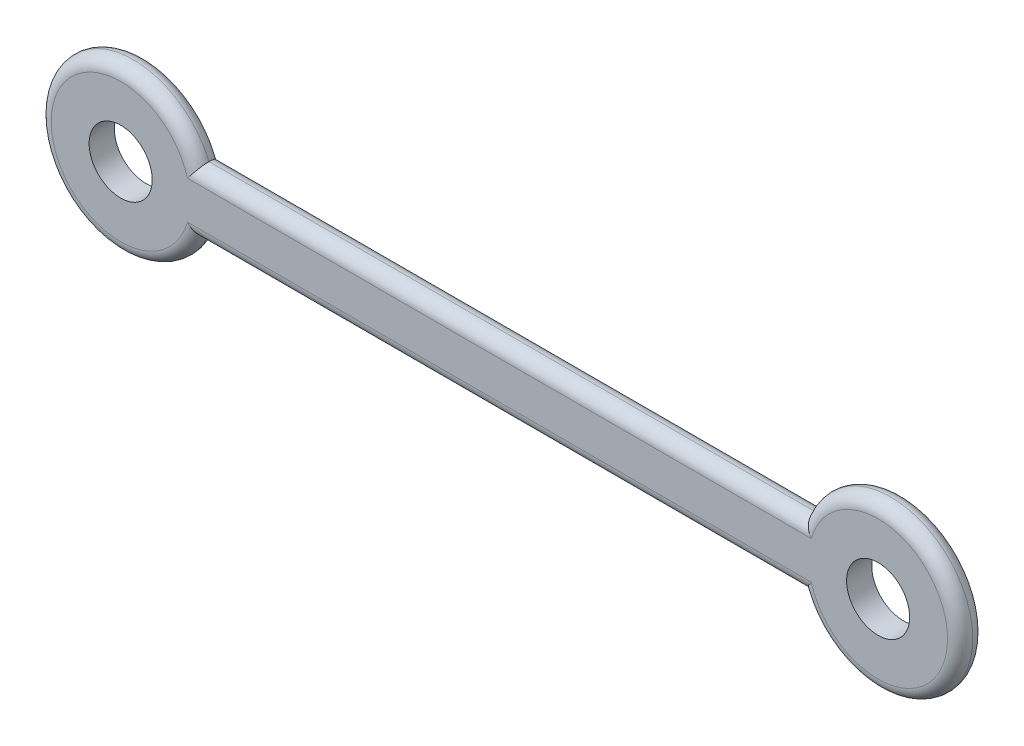
from build123d import *

# Parameters (mm, degrees)
SKETCH1_R           = 6.35
BOSS_EXTRUDE1_DEPTH = 5.08
FILLET1_R           = 2.54
FILLET2_R           = 2.54


with BuildPart() as part:
    # Sketch1 → Boss-Extrude1 (new body)
    with BuildSketch(Plane.XY):
        with BuildLine():
            Line((15.24, -6.35), (137.16, -6.35))
            ThreePointArc((137.16, -6.35), (168.91, 0), (137.16, 6.35))
            Line((137.16, 6.35), (15.24, 6.35))
            ThreePointArc((15.24, 6.35), (-16.51, 0), (15.24, -6.35))
        make_face()
        Circle(SKETCH1_R, mode=Mode.SUBTRACT)
        with Locations((152.4, 0)):
            Circle(SKETCH1_R, mode=Mode.SUBTRACT)
    extrude(amount=BOSS_EXTRUDE1_DEPTH)

    # Fillet1
    fillet1_edges = [part.edges().sort_by_distance(p)[0] for p in [
        (-16.51, 0, 5.08),
        (76.2, -6.35, 5.08),
        (168.91, 0, 5.08),
        (76.2, 6.35, 5.08),
    ]]
    fillet(fillet1_edges, radius=FILLET1_R)

    # Fillet2
    fillet2_edges = [part.edges().sort_by_distance(p)[0] for p in [
        (76.2, -6.35, 0),
        (-16.51, 0, 0),
        (76.2, 6.35, 0),
        (168.91, 0, 0),
    ]]
    fillet(fillet2_edges, radius=FILLET2_R - 0.0001)  # a hair under: the kernel refuses the full size


solid = part.part
